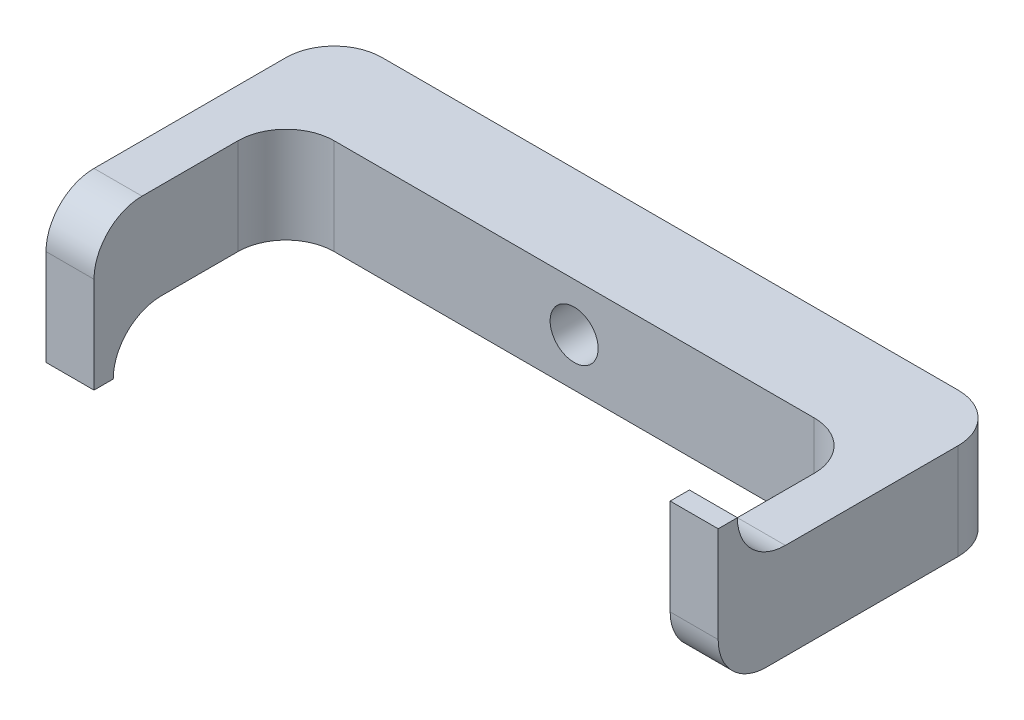
from build123d import *

# Parameters (mm, degrees)
BOSS_EXTRUDE1_DEPTH = 5
SKETCH2_R           = 2.5
CUT_EXTRUDE1_DEPTH  = 41.620192023
SKETCH3_W           = 5
SKETCH3_H           = 15
BOSS_EXTRUDE2_DEPTH = 2
FILLET1_START       = -35
FILLET1_DEPTH       = 5
FILLET1_START_2     = 30
FILLET1_2_DEPTH     = 5
FILLET1_START_3     = -5
FILLET1_3_DEPTH     = 10
FILLET1_4_DEPTH     = 5
FILLET1_5_DEPTH     = 5
FILLET1_6_DEPTH     = 10


with BuildPart() as part:
    # Sketch1 → Boss-Extrude1 (new, symmetric)
    with BuildSketch(Plane(origin=(0, 0, 0), x_dir=(1, 0, 0), z_dir=(0, 1, 0))):
        Polygon((-35, 15), (35, 15), (35, -15), (30, -15), (30, 5), (-30, 5), (-30, -15), (-35, -15), align=None)
    extrude(amount=BOSS_EXTRUDE1_DEPTH, both=True)

    # Sketch2 → Cut-Extrude1 (cut, through all)
    with BuildSketch(Plane.XY.offset(-5)):
        Circle(SKETCH2_R)
    extrude(amount=-CUT_EXTRUDE1_DEPTH, mode=Mode.SUBTRACT)

    # Sketch3 → Boss-Extrude2 (add)
    with BuildSketch(Plane.XY.offset(15)):
        with Locations((-32.5, -2.5)):
            Rectangle(SKETCH3_W, SKETCH3_H)
        with Locations((32.5, 2.5)):
            Rectangle(SKETCH3_W, SKETCH3_H)
    extrude(amount=-BOSS_EXTRUDE2_DEPTH)

    # Fillet1: read off the stored shape, not the designer's step
    # Fillet1 outline → Fillet1 (add)
    with BuildSketch(Plane.YZ.offset(FILLET1_START)):
        with BuildLine():
            Line((-5, 13), (-10, 13))
            ThreePointArc((-10, 13), (-6.464466094, 11.535533906), (-5, 8))
            Line((-5, 8), (-5, 13))
        make_face()
    extrude(amount=FILLET1_DEPTH)

    # Fillet1 2 outline → Fillet1 2 (add)
    with BuildSketch(Plane.YZ.offset(FILLET1_START_2)):
        with BuildLine():
            Line((5, 13), (5, 8))
            ThreePointArc((5, 8), (6.464466094, 11.535533906), (10, 13))
            Line((10, 13), (5, 13))
        make_face()
    extrude(amount=FILLET1_2_DEPTH)

    # Fillet1 3 outline → Fillet1 3 (add)
    with BuildSketch(Plane(origin=(0, 0, 0), x_dir=(1, 0, 0), z_dir=(0, 1, 0)).offset(FILLET1_START_3)):
        with BuildLine():
            Line((-30, 5), (-30, 0))
            ThreePointArc((-30, 0), (-28.535533906, 3.535533906), (-25, 5))
            Line((-25, 5), (-30, 5))
        make_face()
        with BuildLine():
            Line((30, 5), (25, 5))
            ThreePointArc((25, 5), (28.535533906, 3.535533906), (30, 0))
            Line((30, 0), (30, 5))
        make_face()
    extrude(amount=FILLET1_3_DEPTH)

    # Fillet1 4 outline → Fillet1 4 (cut)
    with BuildSketch(Plane.YZ.offset(FILLET1_START)):
        with BuildLine():
            Line((5, 15), (0, 15))
            ThreePointArc((0, 15), (3.535533906, 13.535533906), (5, 10))
            Line((5, 10), (5, 15))
        make_face()
    extrude(amount=FILLET1_4_DEPTH, mode=Mode.SUBTRACT)

    # Fillet1 5 outline → Fillet1 5 (cut)
    with BuildSketch(Plane.YZ.offset(FILLET1_START_2)):
        with BuildLine():
            Line((-5, 15), (-5, 10))
            ThreePointArc((-5, 10), (-3.535533906, 13.535533906), (0, 15))
            Line((0, 15), (-5, 15))
        make_face()
    extrude(amount=FILLET1_5_DEPTH, mode=Mode.SUBTRACT)

    # Fillet1 6 outline → Fillet1 6 (cut)
    with BuildSketch(Plane(origin=(0, 0, 0), x_dir=(1, 0, 0), z_dir=(0, 1, 0)).offset(FILLET1_START_3)):
        with BuildLine():
            Line((-35, 15), (-35, 10))
            ThreePointArc((-35, 10), (-33.535533906, 13.535533906), (-30, 15))
            Line((-30, 15), (-35, 15))
        make_face()
        with BuildLine():
            Line((35, 15), (30, 15))
            ThreePointArc((30, 15), (33.535533906, 13.535533906), (35, 10))
            Line((35, 10), (35, 15))
        make_face()
    extrude(amount=FILLET1_6_DEPTH, mode=Mode.SUBTRACT)


solid = part.part
